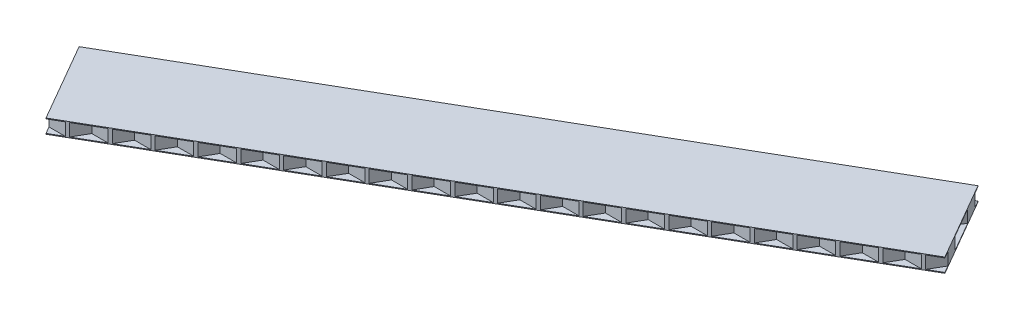
from build123d import *

# Parameters (mm, degrees)
EXTRUDE_THIN1_DEPTH      = 8
BOSS_EXTRUDE1_DEPTH      = 30
BOSS_EXTRUDE1_DEPTH_BACK = 260
SKETCH5_W                = 413.071076938
SKETCH5_H                = 0.5
SKETCH5_W_2              = 415.172711849
CUT_EXTRUDE2_DEPTH       = 250
CUT_EXTRUDE2_DEPTH_BACK  = 250
SKETCH4_W                = 1204.671417947
SKETCH4_H                = 628.870321704


# Read off the part's stored shape, not the designer's step: Extrude-Thin1
with BuildPart() as part:
    # Extrude-Thin1 outline → Extrude-Thin1 (new body)
    with BuildSketch(Plane(origin=(0, 0, 0), x_dir=(1, 0, 0), z_dir=(0, 1, 0))):
        Polygon((-29.444863729, 30), (-23.382685902, 19.5), (-11.835680518, 19.5), (-6.350852961, 10), (-12.124355653, 0), (-6.062177826, -10.5), (6.062177826, -10.5), (11.835680518, -0.5), (23.382685902, -0.5), (29.156188594, 9.5), (40.703193978, 9.5), (46.47669667, 19.5), (58.023702054, 19.5), (63.797204745, 29.5), (75.344210129, 29.5), (81.117712821, 39.5), (92.664718205, 39.5), (98.438220897, 49.5), (109.985226281, 49.5), (115.758728973, 59.5), (127.305734356, 59.5), (133.079237048, 69.5), (144.626242432, 69.5), (150.399745124, 79.5), (161.946750508, 79.5), (167.7202532, 89.5), (179.267258583, 89.5), (185.040761275, 99.5), (196.587766659, 99.5), (202.361269351, 109.5), (213.908274735, 109.5), (219.681777427, 119.5), (231.22878281, 119.5), (237.002285502, 129.5), (248.549290886, 129.5), (254.322793578, 139.5), (265.869798962, 139.5), (271.643301654, 149.5), (283.190307038, 149.5), (288.963809729, 159.5), (300.510815113, 159.5), (306.284317805, 169.5), (317.831323189, 169.5), (323.604825881, 179.5), (335.151831265, 179.5), (340.925333956, 189.5), (352.47233934, 189.5), (358.534517167, 200), (352.47233934, 210.5), (340.925333956, 210.5), (335.440506399, 220), (341.214009091, 230), (335.151831265, 240.5), (323.027475612, 240.5), (317.25397292, 230.5), (305.706967536, 230.5), (299.933464844, 220.5), (288.38645946, 220.5), (282.612956768, 210.5), (271.065951385, 210.5), (265.292448693, 200.5), (253.745443309, 200.5), (247.971940617, 190.5), (236.424935233, 190.5), (230.651432541, 180.5), (219.104427157, 180.5), (213.330924466, 170.5), (201.783919082, 170.5), (196.01041639, 160.5), (184.463411006, 160.5), (178.689908314, 150.5), (167.14290293, 150.5), (161.369400239, 140.5), (149.822394855, 140.5), (144.048892163, 130.5), (132.501886779, 130.5), (126.728384087, 120.5), (115.181378703, 120.5), (109.407876011, 110.5), (97.860870628, 110.5), (92.087367936, 100.5), (80.540362552, 100.5), (74.76685986, 90.5), (63.219854476, 90.5), (57.446351784, 80.5), (45.899346401, 80.5), (40.125843709, 70.5), (28.578838325, 70.5), (22.805335633, 60.5), (11.258330249, 60.5), (5.484827557, 50.5), (-6.062177826, 50.5), (-11.835680518, 40.5), (-23.382685902, 40.5), align=None)
        Polygon((5.484827557, 9.5), (10.969655115, 0), (5.484827557, -9.5), (-5.484827557, -9.5), (-10.969655115, 0), (-5.484827557, 9.5), align=None, mode=Mode.SUBTRACT)
        Polygon((22.805335633, 19.5), (28.29016319, 10), (22.805335633, 0.5), (11.835680518, 0.5), (6.350852961, 10), (11.835680518, 19.5), align=None, mode=Mode.SUBTRACT)
        Polygon((-10.969655115, 20), (-5.484827557, 29.5), (5.484827557, 29.5), (10.969655115, 20), (5.484827557, 10.5), (-5.484827557, 10.5), align=None, mode=Mode.SUBTRACT)
        Polygon((29.156188594, 29.5), (40.125843709, 29.5), (45.610671266, 20), (40.125843709, 10.5), (29.156188594, 10.5), (23.671361037, 20), align=None, mode=Mode.SUBTRACT)
        Polygon((-11.835680518, 20.5), (-22.805335633, 20.5), (-28.29016319, 30), (-22.805335633, 39.5), (-11.835680518, 39.5), (-6.350852961, 30), align=None, mode=Mode.SUBTRACT)
        Polygon((28.29016319, 30), (22.805335633, 20.5), (11.835680518, 20.5), (6.350852961, 30), (11.835680518, 39.5), (22.805335633, 39.5), align=None, mode=Mode.SUBTRACT)
        Polygon((-5.484827557, 30.5), (-10.969655115, 40), (-5.484827557, 49.5), (5.484827557, 49.5), (10.969655115, 40), (5.484827557, 30.5), align=None, mode=Mode.SUBTRACT)
        Polygon((11.835680518, 59.5), (22.805335633, 59.5), (28.29016319, 50), (22.805335633, 40.5), (11.835680518, 40.5), (6.350852961, 50), align=None, mode=Mode.SUBTRACT)
        Polygon((46.47669667, 39.5), (57.446351784, 39.5), (62.931179342, 30), (57.446351784, 20.5), (46.47669667, 20.5), (40.991869112, 30), align=None, mode=Mode.SUBTRACT)
        Polygon((45.610671266, 40), (40.125843709, 30.5), (29.156188594, 30.5), (23.671361037, 40), (29.156188594, 49.5), (40.125843709, 49.5), align=None, mode=Mode.SUBTRACT)
        Polygon((57.446351784, 59.5), (62.931179342, 50), (57.446351784, 40.5), (46.47669667, 40.5), (40.991869112, 50), (46.47669667, 59.5), align=None, mode=Mode.SUBTRACT)
        Polygon((74.76685986, 49.5), (80.251687417, 40), (74.76685986, 30.5), (63.797204745, 30.5), (58.312377188, 40), (63.797204745, 49.5), align=None, mode=Mode.SUBTRACT)
        Polygon((92.087367936, 59.5), (97.572195493, 50), (92.087367936, 40.5), (81.117712821, 40.5), (75.632885264, 50), (81.117712821, 59.5), align=None, mode=Mode.SUBTRACT)
        Polygon((40.125843709, 69.5), (45.610671266, 60), (40.125843709, 50.5), (29.156188594, 50.5), (23.671361037, 60), (29.156188594, 69.5), align=None, mode=Mode.SUBTRACT)
        Polygon((57.446351784, 79.5), (62.931179342, 70), (57.446351784, 60.5), (46.47669667, 60.5), (40.991869112, 70), (46.47669667, 79.5), align=None, mode=Mode.SUBTRACT)
        Polygon((74.76685986, 69.5), (80.251687417, 60), (74.76685986, 50.5), (63.797204745, 50.5), (58.312377188, 60), (63.797204745, 69.5), align=None, mode=Mode.SUBTRACT)
        Polygon((109.407876011, 69.5), (114.892703569, 60), (109.407876011, 50.5), (98.438220897, 50.5), (92.95339334, 60), (98.438220897, 69.5), align=None, mode=Mode.SUBTRACT)
        Polygon((92.087367936, 79.5), (97.572195493, 70), (92.087367936, 60.5), (81.117712821, 60.5), (75.632885264, 70), (81.117712821, 79.5), align=None, mode=Mode.SUBTRACT)
        Polygon((74.76685986, 89.5), (80.251687417, 80), (74.76685986, 70.5), (63.797204745, 70.5), (58.312377188, 80), (63.797204745, 89.5), align=None, mode=Mode.SUBTRACT)
        Polygon((114.892703569, 80), (109.407876011, 70.5), (98.438220897, 70.5), (92.95339334, 80), (98.438220897, 89.5), (109.407876011, 89.5), align=None, mode=Mode.SUBTRACT)
        Polygon((115.758728973, 79.5), (126.728384087, 79.5), (132.213211644, 70), (126.728384087, 60.5), (115.758728973, 60.5), (110.273901415, 70), align=None, mode=Mode.SUBTRACT)
        Polygon((144.048892163, 89.5), (149.53371972, 80), (144.048892163, 70.5), (133.079237048, 70.5), (127.594409491, 80), (133.079237048, 89.5), align=None, mode=Mode.SUBTRACT)
        Polygon((92.087367936, 99.5), (97.572195493, 90), (92.087367936, 80.5), (81.117712821, 80.5), (75.632885264, 90), (81.117712821, 99.5), align=None, mode=Mode.SUBTRACT)
        Polygon((109.407876011, 109.5), (114.892703569, 100), (109.407876011, 90.5), (98.438220897, 90.5), (92.95339334, 100), (98.438220897, 109.5), align=None, mode=Mode.SUBTRACT)
        Polygon((132.213211644, 90), (126.728384087, 80.5), (115.758728973, 80.5), (110.273901415, 90), (115.758728973, 99.5), (126.728384087, 99.5), align=None, mode=Mode.SUBTRACT)
        Polygon((161.369400239, 99.5), (166.854227796, 90), (161.369400239, 80.5), (150.399745124, 80.5), (144.914917567, 90), (150.399745124, 99.5), align=None, mode=Mode.SUBTRACT)
        Polygon((144.048892163, 109.5), (149.53371972, 100), (144.048892163, 90.5), (133.079237048, 90.5), (127.594409491, 100), (133.079237048, 109.5), align=None, mode=Mode.SUBTRACT)
        Polygon((126.728384087, 119.5), (132.213211644, 110), (126.728384087, 100.5), (115.758728973, 100.5), (110.273901415, 110), (115.758728973, 119.5), align=None, mode=Mode.SUBTRACT)
        Polygon((166.854227796, 110), (161.369400239, 100.5), (150.399745124, 100.5), (144.914917567, 110), (150.399745124, 119.5), (161.369400238, 119.5), align=None, mode=Mode.SUBTRACT)
        Polygon((178.689908314, 109.5), (184.174735871, 100), (178.689908314, 90.5), (167.7202532, 90.5), (162.235425642, 100), (167.7202532, 109.5), align=None, mode=Mode.SUBTRACT)
        Polygon((185.040761275, 119.5), (196.01041639, 119.5), (201.495243947, 110), (196.01041639, 100.5), (185.040761275, 100.5), (179.555933718, 110), align=None, mode=Mode.SUBTRACT)
        Polygon((144.048892163, 129.5), (149.53371972, 120), (144.048892163, 110.5), (133.079237048, 110.5), (127.594409491, 120), (133.079237048, 129.5), align=None, mode=Mode.SUBTRACT)
        Polygon((161.369400239, 139.5), (166.854227796, 130), (161.369400239, 120.5), (150.399745124, 120.5), (144.914917567, 130), (150.399745124, 139.5), align=None, mode=Mode.SUBTRACT)
        Polygon((184.174735871, 120), (178.689908314, 110.5), (167.7202532, 110.5), (162.235425642, 120), (167.7202532, 129.5), (178.689908314, 129.5), align=None, mode=Mode.SUBTRACT)
        Polygon((213.330924466, 129.5), (218.815752023, 120), (213.330924466, 110.5), (202.361269351, 110.5), (196.876441794, 120), (202.361269351, 129.5), align=None, mode=Mode.SUBTRACT)
        Polygon((201.495243947, 130), (196.01041639, 120.5), (185.040761275, 120.5), (179.555933718, 130), (185.040761275, 139.5), (196.01041639, 139.5), align=None, mode=Mode.SUBTRACT)
        Polygon((178.689908314, 149.5), (184.174735871, 140), (178.689908314, 130.5), (167.7202532, 130.5), (162.235425642, 140), (167.7202532, 149.5), align=None, mode=Mode.SUBTRACT)
        Polygon((218.815752023, 140), (213.330924466, 130.5), (202.361269351, 130.5), (196.876441794, 140), (202.361269351, 149.5), (213.330924466, 149.5), align=None, mode=Mode.SUBTRACT)
        Polygon((230.651432541, 139.5), (236.136260099, 130), (230.651432541, 120.5), (219.681777427, 120.5), (214.196949869, 130), (219.681777427, 139.5), align=None, mode=Mode.SUBTRACT)
        Polygon((247.971940617, 149.5), (253.456768174, 140), (247.971940617, 130.5), (237.002285502, 130.5), (231.517457945, 140), (237.002285502, 149.5), align=None, mode=Mode.SUBTRACT)
        Polygon((196.01041639, 159.5), (201.495243947, 150), (196.01041639, 140.5), (185.040761275, 140.5), (179.555933718, 150), (185.040761275, 159.5), align=None, mode=Mode.SUBTRACT)
        Polygon((213.330924466, 169.5), (218.815752023, 160), (213.330924466, 150.5), (202.361269351, 150.5), (196.876441794, 160), (202.361269351, 169.5), align=None, mode=Mode.SUBTRACT)
        Polygon((230.651432541, 159.5), (236.136260099, 150), (230.651432541, 140.5), (219.681777427, 140.5), (214.196949869, 150), (219.681777427, 159.5), align=None, mode=Mode.SUBTRACT)
        Polygon((254.322793578, 159.5), (265.292448693, 159.5), (270.77727625, 150), (265.292448693, 140.5), (254.322793578, 140.5), (248.837966021, 150), align=None, mode=Mode.SUBTRACT)
        Polygon((253.456768174, 160), (247.971940617, 150.5), (237.002285502, 150.5), (231.517457945, 160), (237.002285502, 169.5), (247.971940617, 169.5), align=None, mode=Mode.SUBTRACT)
        Polygon((230.651432541, 179.5), (236.136260099, 170), (230.651432541, 160.5), (219.681777427, 160.5), (214.196949869, 170), (219.681777427, 179.5), align=None, mode=Mode.SUBTRACT)
        Polygon((265.292448693, 179.5), (270.77727625, 170), (265.292448693, 160.5), (254.322793578, 160.5), (248.837966021, 170), (254.322793578, 179.5), align=None, mode=Mode.SUBTRACT)
        Polygon((271.643301654, 169.5), (282.612956768, 169.5), (288.097784326, 160), (282.612956768, 150.5), (271.643301654, 150.5), (266.158474096, 160), align=None, mode=Mode.SUBTRACT)
        Polygon((288.963809729, 179.5), (299.933464844, 179.5), (305.418292401, 170), (299.933464844, 160.5), (288.963809729, 160.5), (283.478982172, 170), align=None, mode=Mode.SUBTRACT)
        Polygon((247.971940617, 189.5), (253.456768174, 180), (247.971940617, 170.5), (237.002285502, 170.5), (231.517457945, 180), (237.002285502, 189.5), align=None, mode=Mode.SUBTRACT)
        Polygon((265.292448693, 199.5), (270.77727625, 190), (265.292448693, 180.5), (254.322793578, 180.5), (248.837966021, 190), (254.322793578, 199.5), align=None, mode=Mode.SUBTRACT)
        Polygon((282.612956768, 189.5), (288.097784326, 180), (282.612956768, 170.5), (271.643301654, 170.5), (266.158474096, 180), (271.643301654, 189.5), align=None, mode=Mode.SUBTRACT)
        Polygon((299.933464844, 199.5), (305.418292401, 190), (299.933464844, 180.5), (288.963809729, 180.5), (283.478982172, 190), (288.963809729, 199.5), align=None, mode=Mode.SUBTRACT)
        Polygon((282.612956768, 209.5), (288.097784326, 200), (282.612956768, 190.5), (271.643301654, 190.5), (266.158474096, 200), (271.643301654, 209.5), align=None, mode=Mode.SUBTRACT)
        Polygon((317.25397292, 189.5), (322.738800477, 180), (317.25397292, 170.5), (306.284317805, 170.5), (300.799490248, 180), (306.284317805, 189.5), align=None, mode=Mode.SUBTRACT)
        Polygon((334.574480995, 199.5), (340.059308553, 190), (334.574480995, 180.5), (323.604825881, 180.5), (318.119998323, 190), (323.604825881, 199.5), align=None, mode=Mode.SUBTRACT)
        Polygon((317.25397292, 209.5), (322.738800477, 200), (317.25397292, 190.5), (306.284317805, 190.5), (300.799490248, 200), (306.284317805, 209.5), align=None, mode=Mode.SUBTRACT)
        Polygon((335.440506399, 200), (340.925333956, 209.5), (351.894989071, 209.5), (357.379816628, 200), (351.894989071, 190.5), (340.925333956, 190.5), align=None, mode=Mode.SUBTRACT)
        Polygon((288.963809729, 219.5), (299.933464844, 219.5), (305.418292401, 210), (299.933464844, 200.5), (288.963809729, 200.5), (283.478982172, 210), align=None, mode=Mode.SUBTRACT)
        Polygon((334.574480995, 219.5), (340.059308553, 210), (334.574480995, 200.5), (323.604825881, 200.5), (318.119998323, 210), (323.604825881, 219.5), align=None, mode=Mode.SUBTRACT)
        Polygon((322.738800477, 220), (317.25397292, 210.5), (306.284317805, 210.5), (300.799490248, 220), (306.284317805, 229.5), (317.25397292, 229.5), align=None, mode=Mode.SUBTRACT)
        Polygon((318.119998323, 230), (323.604825881, 239.5), (334.574480995, 239.5), (340.059308553, 230), (334.574480995, 220.5), (323.604825881, 220.5), align=None, mode=Mode.SUBTRACT)
    extrude(amount=EXTRUDE_THIN1_DEPTH)

    # Sketch5 → Boss-Extrude1 (add, two sides: drawn at the far end of the back side and taken through both)
    with BuildSketch(Plane.XY.offset(-BOSS_EXTRUDE1_DEPTH_BACK)):
        with Locations((165.748563745, -0.25)):
            Rectangle(SKETCH5_W, SKETCH5_H)
        with Locations((162.618359658, 8.25)):
            Rectangle(SKETCH5_W_2, SKETCH5_H)
    extrude(amount=BOSS_EXTRUDE1_DEPTH + BOSS_EXTRUDE1_DEPTH_BACK)

    # Sketch4 → Cut-Extrude2 (cut, two sides: drawn at the far end of the back side and taken through both)
    with BuildSketch(Plane(origin=(0, 0, 0), x_dir=(1, 0, 0), z_dir=(0, 1, 0)).offset(-CUT_EXTRUDE2_DEPTH_BACK)):
        with Locations((241.213932553, 99.129138916)):
            Rectangle(SKETCH4_W, SKETCH4_H)
        Polygon((-31.754264805, 35), (331.976404784, 245), (360.843918244, 195), (-2.886751346, -15), align=None, mode=Mode.SUBTRACT)
    extrude(amount=CUT_EXTRUDE2_DEPTH + CUT_EXTRUDE2_DEPTH_BACK, mode=Mode.SUBTRACT)


solid = part.part
